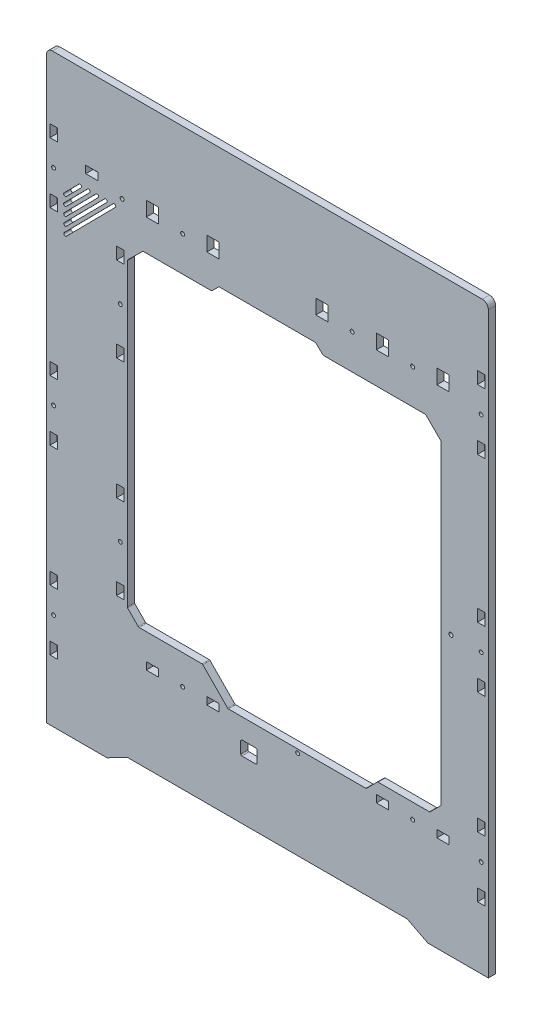
from build123d import *

# Parameters (mm, degrees)
SKETCH_1_W      = 6.1
SKETCH_1_H      = 10
SKETCH_1_R      = 1.6
SKETCH_1_W_2    = 10
SKETCH_1_H_2    = 6.1
SKETCH_1_R_2    = 1.7
SKETCH_1_H_3    = 12.1
EXTRUDE_1_DEPTH = 6


with BuildPart() as part:
    # Эскиз1 → Бобышка-Вытянуть1 (new body)
    with BuildSketch(Plane.XY):
        with BuildLine():
            Line((1133.366546195, 42.00723929), (1133.366546195, 477.00723929))
            Line((1133.366546195, 477.00723929), (1133.366546195, 520.00723929))
            ThreePointArc((1133.366546195, 520.00723929), (1131.902080101, 523.542773196), (1128.366546195, 525.00723929))
            Line((1128.366546195, 525.00723929), (773.366546195, 525.00723929))
            ThreePointArc((773.366546195, 525.00723929), (769.831012289, 523.542773196), (768.366546195, 520.00723929))
            Line((768.366546195, 520.00723929), (768.366546195, 477.00723929))
            Line((768.366546195, 477.00723929), (768.366546195, 42.00723929))
            Line((768.366546195, 42.00723929), (818.366546195, 42.00723929))
            Line((818.366546195, 42.00723929), (835.366546195, 50.73749629))
            Line((835.366546195, 50.73749629), (1066.366546195, 50.73749629))
            Line((1066.366546195, 50.73749629), (1083.366546195, 42.00723929))
            Line((1083.366546195, 42.00723929), (1133.366546195, 42.00723929))
        make_face()
        with Locations((774.316546195, 97.00723929)):
            Rectangle(SKETCH_1_W, SKETCH_1_H, mode=Mode.SUBTRACT)
        with Locations((774.316546195, 122.00723929)):
            Circle(SKETCH_1_R, mode=Mode.SUBTRACT)
        with Locations((774.316546195, 147.00723929)):
            Rectangle(SKETCH_1_W, SKETCH_1_H, mode=Mode.SUBTRACT)
        with Locations((855.866546195, 124.05491429)):
            Rectangle(SKETCH_1_W_2, SKETCH_1_H_2, mode=Mode.SUBTRACT)
        with Locations((880.866546195, 124.05491429)):
            Circle(SKETCH_1_R, mode=Mode.SUBTRACT)
        with Locations((905.866546195, 124.05491429)):
            Rectangle(SKETCH_1_W_2, SKETCH_1_H_2, mode=Mode.SUBTRACT)
        with BuildLine():
            Line((929.866546195, 110.50491429), (941.366546195, 110.50491429))
            ThreePointArc((941.366546195, 110.50491429), (942.073652976, 110.212021071), (942.366546195, 109.50491429))
            Line((942.366546195, 109.50491429), (942.366546195, 100.00491429))
            ThreePointArc((942.366546195, 100.00491429), (942.073652976, 99.297807509), (941.366546195, 99.00491429))
            Line((941.366546195, 99.00491429), (929.866546195, 99.00491429))
            ThreePointArc((929.866546195, 99.00491429), (929.159439413, 99.297807509), (928.866546195, 100.00491429))
            Line((928.866546195, 100.00491429), (928.866546195, 109.50491429))
            ThreePointArc((928.866546195, 109.50491429), (929.159439413, 110.212021071), (929.866546195, 110.50491429))
        make_face(mode=Mode.SUBTRACT)
        with Locations((829.416546195, 167.00723929)):
            Rectangle(SKETCH_1_W, SKETCH_1_H, mode=Mode.SUBTRACT)
        with Locations((829.416546195, 202.00723929)):
            Circle(SKETCH_1_R, mode=Mode.SUBTRACT)
        with Locations((774.316546195, 247.00723929)):
            Rectangle(SKETCH_1_W, SKETCH_1_H, mode=Mode.SUBTRACT)
        with Locations((774.316546195, 272.00723929)):
            Circle(SKETCH_1_R, mode=Mode.SUBTRACT)
        with Locations((829.416546195, 237.00723929)):
            Rectangle(SKETCH_1_W, SKETCH_1_H, mode=Mode.SUBTRACT)
        with Locations((975.866546195, 124.05491402)):
            Circle(SKETCH_1_R, mode=Mode.SUBTRACT)
        with Locations((1127.416546195, 97.00723929)):
            Rectangle(SKETCH_1_W, SKETCH_1_H, mode=Mode.SUBTRACT)
        with Locations((1045.866546195, 124.05491429)):
            Rectangle(SKETCH_1_W_2, SKETCH_1_H_2, mode=Mode.SUBTRACT)
        with Locations((1070.866546195, 124.05491429)):
            Circle(SKETCH_1_R, mode=Mode.SUBTRACT)
        with Locations((1095.866546195, 124.05491429)):
            Rectangle(SKETCH_1_W_2, SKETCH_1_H_2, mode=Mode.SUBTRACT)
        with Locations((1127.416546195, 122.00723929)):
            Circle(SKETCH_1_R, mode=Mode.SUBTRACT)
        with Locations((1127.416546195, 147.00723929)):
            Rectangle(SKETCH_1_W, SKETCH_1_H, mode=Mode.SUBTRACT)
        with BuildLine():
            Line((991.452332632, 424.583526443), (996.280759757, 419.755099318))
            ThreePointArc((996.280759757, 419.755099318), (996.929606455, 419.321553816), (997.694973319, 419.169312881))
            Line((997.694973319, 419.169312881), (1081.122260515, 419.169312881))
            ThreePointArc((1081.122260515, 419.169312881), (1081.50331118, 419.093867148), (1081.826864515, 418.878913881))
            Line((1081.826864515, 418.878913881), (1094.120077515, 406.672272881))
            ThreePointArc((1094.120077515, 406.672272881), (1094.338675602, 406.346986998), (1094.415473515, 405.962671881))
            Line((1094.415473515, 405.962671881), (1094.415473515, 146.420031881))
            ThreePointArc((1094.415473515, 146.420031881), (1094.340368819, 146.039810505), (1094.126336515, 145.716701881))
            Line((1094.126336515, 145.716701881), (1085.357153515, 136.853593881))
            ThreePointArc((1085.357153515, 136.853593881), (1085.031432616, 136.634066807), (1084.646289515, 136.556923881))
            Line((1084.646289515, 136.556923881), (1042.289008515, 136.556923881))
            ThreePointArc((1042.289008515, 136.556923881), (1041.903865529, 136.479781416), (1041.578144515, 136.260254881))
            Line((1041.578144515, 136.260254881), (1032.813350515, 127.401582881))
            ThreePointArc((1032.813350515, 127.401582881), (1032.487630078, 127.182055999), (1032.102487515, 127.104912881))
            Line((1032.102487515, 127.104912881), (918.728979515, 127.104912881))
            ThreePointArc((918.728979515, 127.104912881), (918.34230769, 127.182695398), (918.015788515, 127.403942881))
            Line((918.015788515, 127.403942881), (897.574498515, 148.201603881))
            ThreePointArc((897.574498515, 148.201603881), (897.24797934, 148.422851364), (896.861307515, 148.500633881))
            Line((896.861307515, 148.500633881), (844.938460515, 148.500633881))
            ThreePointArc((844.938460515, 148.500633881), (844.553318068, 148.577776538), (844.227597515, 148.797302881))
            Line((844.227597515, 148.797302881), (835.458413515, 157.660410881))
            ThreePointArc((835.458413515, 157.660410881), (835.244381748, 157.983519619), (835.169277515, 158.363740881))
            Line((835.169277515, 158.363740881), (835.169277515, 405.962671881))
            ThreePointArc((835.169277515, 405.962671881), (835.246075427, 406.346986998), (835.464673515, 406.672272881))
            Line((835.464673515, 406.672272881), (847.757886515, 418.878913881))
            ThreePointArc((847.757886515, 418.878913881), (848.08143985, 419.093867148), (848.462490515, 419.169312881))
            Line((848.462490515, 419.169312881), (904.03811907, 419.169312881))
            ThreePointArc((904.03811907, 419.169312881), (904.803485935, 419.321553816), (905.452332632, 419.755099318))
            Line((905.452332632, 419.755099318), (910.280759757, 424.583526443))
            ThreePointArc((910.280759757, 424.583526443), (910.929606455, 425.017071946), (911.694973319, 425.169312881))
            Line((911.694973319, 425.169312881), (990.03811907, 425.169312881))
            ThreePointArc((990.03811907, 425.169312881), (990.803485935, 425.017071946), (991.452332632, 424.583526443))
        make_face(mode=Mode.SUBTRACT)
        with Locations((1127.416546195, 247.00723929)):
            Rectangle(SKETCH_1_W, SKETCH_1_H, mode=Mode.SUBTRACT)
        with Locations((1102.521049053, 272.00723929)):
            Circle(SKETCH_1_R_2, mode=Mode.SUBTRACT)
        with Locations((1127.416546195, 272.00723929)):
            Circle(SKETCH_1_R, mode=Mode.SUBTRACT)
        with Locations((774.316546195, 297.00723929)):
            Rectangle(SKETCH_1_W, SKETCH_1_H, mode=Mode.SUBTRACT)
        with Locations((829.416546195, 337.00723929)):
            Rectangle(SKETCH_1_W, SKETCH_1_H, mode=Mode.SUBTRACT)
        with Locations((829.416546195, 372.00723929)):
            Circle(SKETCH_1_R, mode=Mode.SUBTRACT)
        with Locations((774.316546195, 417.00723929)):
            Rectangle(SKETCH_1_W, SKETCH_1_H, mode=Mode.SUBTRACT)
        with BuildLine():
            Line((797.021693195, 438.99752529), (784.715878195, 426.55498029))
            ThreePointArc((784.715878195, 426.55498029), (782.948138695, 426.54521379), (782.938372195, 428.31295329))
            Line((782.938372195, 428.31295329), (795.244186195, 440.75549829))
            ThreePointArc((795.244186195, 440.75549829), (797.011926195, 440.76526529), (797.021693195, 438.99752529))
        make_face(mode=Mode.SUBTRACT)
        with BuildLine():
            Line((818.234572195, 439.11472329), (784.833077195, 405.34210029))
            ThreePointArc((784.833077195, 405.34210029), (783.065337195, 405.33233329), (783.055570195, 407.10007329))
            Line((783.055570195, 407.10007329), (816.457066195, 440.87269729))
            ThreePointArc((816.457066195, 440.87269729), (818.224806195, 440.88246329), (818.234572195, 439.11472329))
        make_face(mode=Mode.SUBTRACT)
        with BuildLine():
            Line((811.163612195, 439.07565729), (784.794011195, 412.41306029))
            ThreePointArc((784.794011195, 412.41306029), (783.026271195, 412.40329329), (783.016504195, 414.17103329))
            Line((783.016504195, 414.17103329), (809.386106195, 440.83363129))
            ThreePointArc((809.386106195, 440.83363129), (811.153846195, 440.84339729), (811.163612195, 439.07565729))
        make_face(mode=Mode.SUBTRACT)
        with BuildLine():
            Line((804.092652195, 439.03659129), (784.754944195, 419.48402029))
            ThreePointArc((784.754944195, 419.48402029), (782.987204695, 419.47425379), (782.977438195, 421.24199329))
            Line((782.977438195, 421.24199329), (802.315146195, 440.79456529))
            ThreePointArc((802.315146195, 440.79456529), (804.082886195, 440.80433129), (804.092652195, 439.03659129))
        make_face(mode=Mode.SUBTRACT)
        with BuildLine():
            Line((825.305532195, 439.15378929), (784.872143195, 398.27114029))
            ThreePointArc((784.872143195, 398.27114029), (783.104403195, 398.26137329), (783.094636195, 400.02911329))
            Line((783.094636195, 400.02911329), (823.528026195, 440.91176329))
            ThreePointArc((823.528026195, 440.91176329), (825.295766195, 440.92152929), (825.305532195, 439.15378929))
        make_face(mode=Mode.SUBTRACT)
        with Locations((774.316546195, 442.00723929)):
            Circle(SKETCH_1_R, mode=Mode.SUBTRACT)
        with Locations((805.866546195, 454.05723929)):
            Rectangle(SKETCH_1_W_2, SKETCH_1_H_2, mode=Mode.SUBTRACT)
        with Locations((829.416546195, 407.00723929)):
            Rectangle(SKETCH_1_W, SKETCH_1_H, mode=Mode.SUBTRACT)
        with Locations((830.866546195, 448.05723929)):
            Circle(SKETCH_1_R, mode=Mode.SUBTRACT)
        with Locations((855.866546195, 451.05723929)):
            Rectangle(SKETCH_1_W_2, SKETCH_1_H_3, mode=Mode.SUBTRACT)
        with Locations((774.316546195, 467.00723929)):
            Rectangle(SKETCH_1_W, SKETCH_1_H, mode=Mode.SUBTRACT)
        with Locations((880.866546195, 448.05723929)):
            Circle(SKETCH_1_R, mode=Mode.SUBTRACT)
        with Locations((905.866546195, 451.05723929)):
            Rectangle(SKETCH_1_W_2, SKETCH_1_H_3, mode=Mode.SUBTRACT)
        with Locations((1127.416546195, 297.00723929)):
            Rectangle(SKETCH_1_W, SKETCH_1_H, mode=Mode.SUBTRACT)
        with Locations((995.866546195, 451.05723929)):
            Rectangle(SKETCH_1_W_2, SKETCH_1_H_3, mode=Mode.SUBTRACT)
        with Locations((1020.866546195, 448.05723929)):
            Circle(SKETCH_1_R, mode=Mode.SUBTRACT)
        with Locations((1045.866546195, 451.05723929)):
            Rectangle(SKETCH_1_W_2, SKETCH_1_H_3, mode=Mode.SUBTRACT)
        with Locations((1070.866546195, 448.05723929)):
            Circle(SKETCH_1_R, mode=Mode.SUBTRACT)
        with Locations((1127.416546195, 417.00723929)):
            Rectangle(SKETCH_1_W, SKETCH_1_H, mode=Mode.SUBTRACT)
        with Locations((1095.866546195, 451.05723929)):
            Rectangle(SKETCH_1_W_2, SKETCH_1_H_3, mode=Mode.SUBTRACT)
        with Locations((1127.416546195, 442.00723929)):
            Circle(SKETCH_1_R, mode=Mode.SUBTRACT)
        with Locations((1127.416546195, 467.00723929)):
            Rectangle(SKETCH_1_W, SKETCH_1_H, mode=Mode.SUBTRACT)
    extrude(amount=EXTRUDE_1_DEPTH)


solid = part.part
